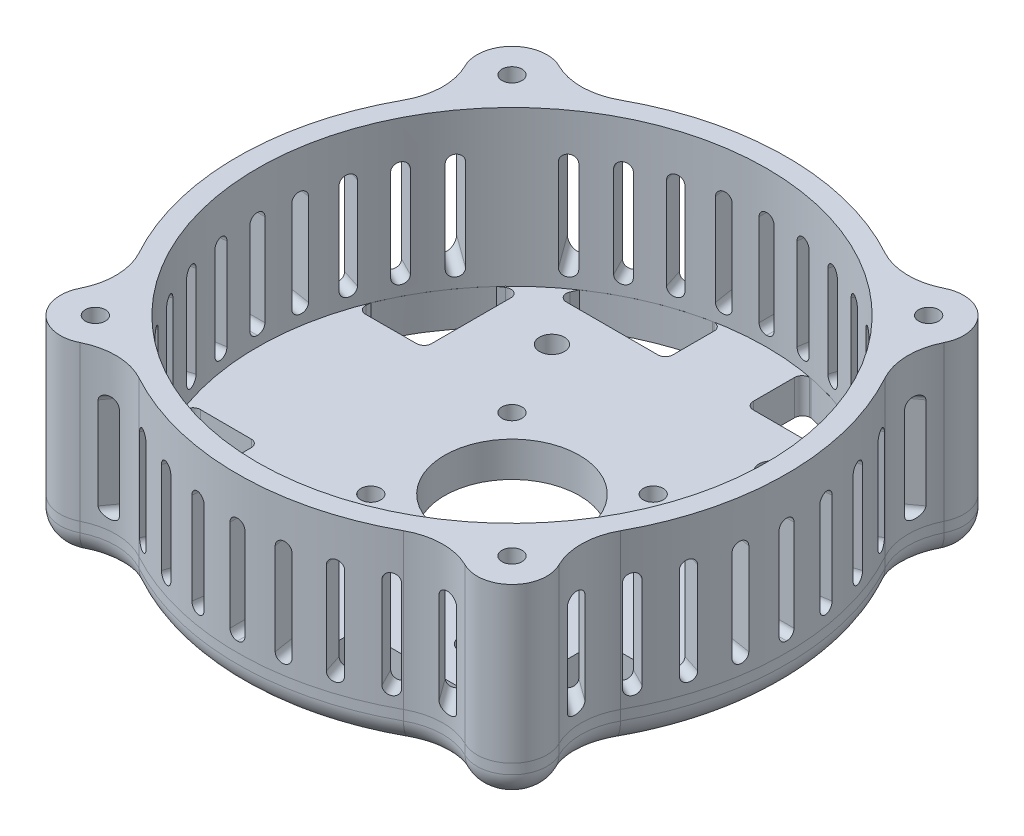
from build123d import *

# Parameters (mm, degrees)
SKETCH1_R                 = 50.99999999999999
SKETCH1_R_2               = 1.9999999999999967
SKETCH1_R_3               = 1.999999999999995
SKETCH1_R_4               = 1.9999999999999991
SKETCH1_R_5               = 1.9999999999999973
BOSS_EXTRUDE1_DEPTH       = 31
SKETCH2_R                 = 2.4999999999999982
SKETCH2_R_2               = 2.000000000000002
SKETCH2_R_3               = 2.000000000000708
SKETCH2_R_4               = 1.9999999999995886
SKETCH2_R_5               = 13.5
SKETCH2_R_6               = 2.0000000000004103
SKETCH2_R_7               = 2.0000000000000036
SKETCH2_R_8               = 1.9999999999999967
SKETCH2_R_9               = 1.999999999999995
BOSS_EXTRUDE2_DEPTH       = 7
FILLET1_R                 = 5
CUT_EXTRUDE1_DEPTH        = 61.000000000000036
CIRPATTERN1_COUNT         = 5
CIRPATTERN1_ANGLE         = 36.00000000000008
MIRROR1_COPY_1_DEPTH      = 61.000000000000036
MIRROR1_COPY_2_DEPTH      = 61.000000000000036
MIRROR1_COPY_3_DEPTH      = 61.000000000000036
MIRROR1_COPY_4_DEPTH      = 61.000000000000036
MIRROR2_COPY_1_DEPTH      = 61.000000000000036
MIRROR2_COPY_2_DEPTH      = 61.000000000000036
MIRROR2_COPY_3_DEPTH      = 61.000000000000036
MIRROR2_COPY_4_DEPTH      = 61.000000000000036
MIRROR2_COPY_5_DEPTH      = 61.000000000000036
MIRROR2_COPY_6_DEPTH      = 61.000000000000036
MIRROR2_COPY_7_DEPTH      = 61.000000000000036
MIRROR2_COPY_8_DEPTH      = 61.000000000000036
MIRROR2_COPY_9_DEPTH      = 61.000000000000036
CIRPATTERN2_COUNT         = 2
CIRPATTERN2_ANGLE         = 90.0000000000002
CIRPATTERN2_COPY_1_DEPTH  = 61.000000000000036
CIRPATTERN2_COPY_2_DEPTH  = 61.000000000000036
CIRPATTERN2_COPY_3_DEPTH  = 61.000000000000036
CIRPATTERN2_COPY_4_DEPTH  = 61.000000000000036
CIRPATTERN2_COPY_5_DEPTH  = 61.000000000000036
CIRPATTERN2_COPY_6_DEPTH  = 61.000000000000036
CIRPATTERN2_COPY_7_DEPTH  = 61.000000000000036
CIRPATTERN2_COPY_8_DEPTH  = 61.000000000000036
CIRPATTERN2_COPY_9_DEPTH  = 61.000000000000036
CIRPATTERN2_COPY_10_DEPTH = 61.000000000000036
CIRPATTERN2_COPY_11_DEPTH = 61.000000000000036
CIRPATTERN2_COPY_12_DEPTH = 61.000000000000036
CIRPATTERN2_COPY_13_DEPTH = 61.000000000000036
CIRPATTERN2_COPY_14_DEPTH = 61.000000000000036
CIRPATTERN2_COPY_15_DEPTH = 61.000000000000036
CIRPATTERN2_COPY_16_DEPTH = 61.000000000000036
CIRPATTERN2_COPY_17_DEPTH = 61.000000000000036
CIRPATTERN2_COPY_18_DEPTH = 61.000000000000036
CIRPATTERN2_COPY_19_DEPTH = 61.000000000000036
SKETCH4_R                 = 4.9999999999999964
SKETCH4_R_2               = 4.999999999999999
SKETCH4_R_3               = 4.999999999999993
SKETCH4_R_4               = 4.999999999999996
CUT_EXTRUDE2_DEPTH        = 15


with BuildPart() as part:
    # Sketch1 → Boss-Extrude1 (new body)
    with BuildSketch(Plane(origin=(0, 0, 0), x_dir=(1, 0, 0), z_dir=(0, 1, 0))):
        with BuildLine():
            ThreePointArc((48.20155884663504, -26.48791658010083), (55.00000000000001, -2.8699e-13), (48.2015588466353, 26.48791658010032))
            ThreePointArc((48.2015588466353, 26.48791658010032), (46.59692233698166, 32.50588686656754), (47.9756748963486, 38.57958969737471))
            ThreePointArc((47.9756748963486, 38.57958969737471), (46.6690486920612, 46.66904869206024), (38.579589697375695, 47.97567489634781))
            ThreePointArc((38.579589697375695, 47.97567489634781), (32.50588686656851, 46.59692233698101), (26.48791658010132, 48.201558846634754))
            ThreePointArc((26.48791658010132, 48.201558846634754), (4.9187e-13, 54.99999999999999), (-26.487916580100485, 48.20155884663524))
            ThreePointArc((-26.487916580100485, 48.20155884663524), (-32.50588686656771, 46.59692233698159), (-38.57958969737487, 47.9756748963485))
            ThreePointArc((-38.57958969737487, 47.9756748963485), (-46.6690486920604, 46.669048692061075), (-47.97567489634794, 38.57958969737556))
            ThreePointArc((-47.97567489634794, 38.57958969737556), (-46.59692233698111, 32.505886866568375), (-48.201558846634846, 26.487916580101178))
            ThreePointArc((-48.201558846634846, 26.487916580101178), (-55.00000000000001, 2.9983e-13), (-48.20155884663513, -26.487916580100645))
            ThreePointArc((-48.20155884663513, -26.487916580100645), (-46.59692233698145, -32.505886866567856), (-47.975674896348345, -38.57958969737503))
            ThreePointArc((-47.975674896348345, -38.57958969737503), (-46.6690486920609, -46.66904869206056), (-38.579589697375376, -47.97567489634807))
            ThreePointArc((-38.579589697375376, -47.97567489634807), (-32.5058868665682, -46.596922336981216), (-26.487916580101, -48.20155884663493))
            ThreePointArc((-26.487916580101, -48.20155884663493), (-9.433e-14, -55), (26.48791658010083, -48.20155884663504))
            ThreePointArc((26.48791658010083, -48.20155884663504), (32.50588686656804, -46.59692233698134), (38.57958969737521, -47.97567489634822))
            ThreePointArc((38.57958969737521, -47.97567489634822), (46.669048692060734, -46.669048692060734), (47.97567489634822, -38.57958969737521))
            ThreePointArc((47.97567489634822, -38.57958969737521), (46.59692233698134, -32.50588686656804), (48.20155884663504, -26.48791658010083))
        make_face()
        with Locations(Location((0, 0, 0), (0, 0, 270))):
            Circle(SKETCH1_R, mode=Mode.SUBTRACT)
        with Locations(Location((41.71930122375488, -41.71930122375488, 0), (0, 0, 270))):
            Circle(SKETCH1_R_2, mode=Mode.SUBTRACT)
        with Locations(Location((-41.71930122375503, -41.71930122375474, 0), (0, 0, 270))):
            Circle(SKETCH1_R_3, mode=Mode.SUBTRACT)
        with Locations(Location((-41.71930122375459, 41.719301223755174, 0), (0, 0, 270))):
            Circle(SKETCH1_R_4, mode=Mode.SUBTRACT)
        with Locations(Location((41.71930122375532, 41.71930122375444, 0), (0, 0, 270))):
            Circle(SKETCH1_R_5, mode=Mode.SUBTRACT)
    extrude(amount=BOSS_EXTRUDE1_DEPTH)

    # Sketch3 → Cut-Extrude1 (cut)
    with BuildSketch(Plane(origin=(0, 0, 0), x_dir=(0, 0, -1), z_dir=(1, 0, 0))):
        with BuildLine():
            Line((-1.4238717555999756, 21.88270378112793), (-1.4238717555999756, 3.5))
            ThreePointArc((-1.4238717555999756, 3.5), (0.03806412220001153, 2.0380641222000127), (1.5, 3.5))
            Line((1.5, 3.5), (1.5, 21.88270378112793))
            ThreePointArc((1.5, 21.88270378112793), (0.03806412220001189, 23.344639658927917), (-1.4238717555999756, 21.88270378112793))
        make_face()
    cut_extrude1 = extrude(amount=CUT_EXTRUDE1_DEPTH, mode=Mode.SUBTRACT)

    # CirPattern1: Cut-Extrude1 ×5 about axis
    cirpattern1_axis = Axis((2.49e-15, 0, -2.81e-15), (0, -1, 0))
    for i in range(1, CIRPATTERN1_COUNT):
        add(cut_extrude1.rotate(cirpattern1_axis, i * CIRPATTERN1_ANGLE / (CIRPATTERN1_COUNT - 1)), mode=Mode.SUBTRACT)

    # Mirror1: Cut-Extrude1 across plane
    add(cut_extrude1.mirror(Plane.XY), mode=Mode.SUBTRACT)

    # Mirror1 copy 1 sketch → Mirror1 copy 1 (cut)
    with BuildSketch(Plane(origin=(-4.1e-16, 0, 4.2e-16), x_dir=(0.1564344650402312, 0, 0.9876883405951377), z_dir=(0.9876883405951377, 0, -0.1564344650402312))):
        with BuildLine():
            Line((-1.4238717555999756, -21.88270378112793), (-1.4238717555999756, -3.5))
            ThreePointArc((-1.4238717555999756, -3.5), (0.03806412220001153, -2.0380641222000127), (1.5, -3.5))
            Line((1.5, -3.5), (1.5, -21.88270378112793))
            ThreePointArc((1.5, -21.88270378112793), (0.03806412220001189, -23.344639658927917), (-1.4238717555999756, -21.88270378112793))
        make_face()
    extrude(amount=MIRROR1_COPY_1_DEPTH, mode=Mode.SUBTRACT)

    # Mirror1 copy 2 sketch → Mirror1 copy 2 (cut)
    with BuildSketch(Plane(origin=(-7.5e-16, 0, 9.1e-16), x_dir=(0.30901699437494806, 0, 0.9510565162951534), z_dir=(0.9510565162951534, 0, -0.30901699437494806))):
        with BuildLine():
            Line((-1.4238717555999756, -21.88270378112793), (-1.4238717555999756, -3.5))
            ThreePointArc((-1.4238717555999756, -3.5), (0.03806412220001153, -2.0380641222000127), (1.5, -3.5))
            Line((1.5, -3.5), (1.5, -21.88270378112793))
            ThreePointArc((1.5, -21.88270378112793), (0.03806412220001189, -23.344639658927917), (-1.4238717555999756, -21.88270378112793))
        make_face()
    extrude(amount=MIRROR1_COPY_2_DEPTH, mode=Mode.SUBTRACT)

    # Mirror1 copy 3 sketch → Mirror1 copy 3 (cut)
    with BuildSketch(Plane(origin=(-1e-15, 0, 1.44e-15), x_dir=(0.4539904997395477, 0, 0.8910065241883675), z_dir=(0.8910065241883675, 0, -0.4539904997395477))):
        with BuildLine():
            Line((-1.4238717555999756, -21.88270378112793), (-1.4238717555999756, -3.5))
            ThreePointArc((-1.4238717555999756, -3.5), (0.03806412220001153, -2.0380641222000127), (1.5, -3.5))
            Line((1.5, -3.5), (1.5, -21.88270378112793))
            ThreePointArc((1.5, -21.88270378112793), (0.03806412220001189, -23.344639658927917), (-1.4238717555999756, -21.88270378112793))
        make_face()
    extrude(amount=MIRROR1_COPY_3_DEPTH, mode=Mode.SUBTRACT)

    # Mirror1 copy 4 sketch → Mirror1 copy 4 (cut)
    with BuildSketch(Plane(origin=(-1.18e-15, 0, 2e-15), x_dir=(0.5877852522924741, 0, 0.8090169943749467), z_dir=(0.8090169943749467, 0, -0.5877852522924741))):
        with BuildLine():
            Line((-1.4238717555999756, -21.88270378112793), (-1.4238717555999756, -3.5))
            ThreePointArc((-1.4238717555999756, -3.5), (0.03806412220001153, -2.0380641222000127), (1.5, -3.5))
            Line((1.5, -3.5), (1.5, -21.88270378112793))
            ThreePointArc((1.5, -21.88270378112793), (0.03806412220001189, -23.344639658927917), (-1.4238717555999756, -21.88270378112793))
        make_face()
    extrude(amount=MIRROR1_COPY_4_DEPTH, mode=Mode.SUBTRACT)

    # Mirror2: Cut-Extrude1 across plane
    add(cut_extrude1.mirror(Plane(origin=(0, 0, 0), x_dir=(0, 0, 1), z_dir=(1, 0, 0))), mode=Mode.SUBTRACT)

    # Mirror2 copy 1 sketch → Mirror2 copy 1 (cut)
    with BuildSketch(Plane(origin=(4.1e-16, 0, -4.2e-16), x_dir=(-0.1564344650402312, 0, -0.9876883405951377), z_dir=(-0.9876883405951377, 0, 0.1564344650402312))):
        with BuildLine():
            Line((-1.4238717555999756, -21.88270378112793), (-1.4238717555999756, -3.5))
            ThreePointArc((-1.4238717555999756, -3.5), (0.03806412220001153, -2.0380641222000127), (1.5, -3.5))
            Line((1.5, -3.5), (1.5, -21.88270378112793))
            ThreePointArc((1.5, -21.88270378112793), (0.03806412220001189, -23.344639658927917), (-1.4238717555999756, -21.88270378112793))
        make_face()
    extrude(amount=MIRROR2_COPY_1_DEPTH, mode=Mode.SUBTRACT)

    # Mirror2 copy 2 sketch → Mirror2 copy 2 (cut)
    with BuildSketch(Plane(origin=(7.5e-16, 0, -9.1e-16), x_dir=(-0.30901699437494806, 0, -0.9510565162951534), z_dir=(-0.9510565162951534, 0, 0.30901699437494806))):
        with BuildLine():
            Line((-1.4238717555999756, -21.88270378112793), (-1.4238717555999756, -3.5))
            ThreePointArc((-1.4238717555999756, -3.5), (0.03806412220001153, -2.0380641222000127), (1.5, -3.5))
            Line((1.5, -3.5), (1.5, -21.88270378112793))
            ThreePointArc((1.5, -21.88270378112793), (0.03806412220001189, -23.344639658927917), (-1.4238717555999756, -21.88270378112793))
        make_face()
    extrude(amount=MIRROR2_COPY_2_DEPTH, mode=Mode.SUBTRACT)

    # Mirror2 copy 3 sketch → Mirror2 copy 3 (cut)
    with BuildSketch(Plane(origin=(1e-15, 0, -1.44e-15), x_dir=(-0.4539904997395477, 0, -0.8910065241883675), z_dir=(-0.8910065241883675, 0, 0.4539904997395477))):
        with BuildLine():
            Line((-1.4238717555999756, -21.88270378112793), (-1.4238717555999756, -3.5))
            ThreePointArc((-1.4238717555999756, -3.5), (0.03806412220001153, -2.0380641222000127), (1.5, -3.5))
            Line((1.5, -3.5), (1.5, -21.88270378112793))
            ThreePointArc((1.5, -21.88270378112793), (0.03806412220001189, -23.344639658927917), (-1.4238717555999756, -21.88270378112793))
        make_face()
    extrude(amount=MIRROR2_COPY_3_DEPTH, mode=Mode.SUBTRACT)

    # Mirror2 copy 4 sketch → Mirror2 copy 4 (cut)
    with BuildSketch(Plane(origin=(1.18e-15, 0, -2e-15), x_dir=(-0.5877852522924741, 0, -0.8090169943749467), z_dir=(-0.8090169943749467, 0, 0.5877852522924741))):
        with BuildLine():
            Line((-1.4238717555999756, -21.88270378112793), (-1.4238717555999756, -3.5))
            ThreePointArc((-1.4238717555999756, -3.5), (0.03806412220001153, -2.0380641222000127), (1.5, -3.5))
            Line((1.5, -3.5), (1.5, -21.88270378112793))
            ThreePointArc((1.5, -21.88270378112793), (0.03806412220001189, -23.344639658927917), (-1.4238717555999756, -21.88270378112793))
        make_face()
    extrude(amount=MIRROR2_COPY_4_DEPTH, mode=Mode.SUBTRACT)

    # Mirror2 copy 5 sketch → Mirror2 copy 5 (cut)
    with BuildSketch(Plane.ZY):
        with BuildLine():
            Line((-1.4238717555999756, 21.88270378112793), (-1.4238717555999756, 3.5))
            ThreePointArc((-1.4238717555999756, 3.5), (0.03806412220001153, 2.0380641222000127), (1.5, 3.5))
            Line((1.5, 3.5), (1.5, 21.88270378112793))
            ThreePointArc((1.5, 21.88270378112793), (0.03806412220001189, 23.344639658927917), (-1.4238717555999756, 21.88270378112793))
        make_face()
    extrude(amount=MIRROR2_COPY_5_DEPTH, mode=Mode.SUBTRACT)

    # Mirror2 copy 6 sketch → Mirror2 copy 6 (cut)
    with BuildSketch(Plane(origin=(4.1e-16, 0, 4.2e-16), x_dir=(-0.1564344650402312, 0, 0.9876883405951377), z_dir=(-0.9876883405951377, 0, -0.1564344650402312))):
        with BuildLine():
            Line((-1.4238717555999756, 21.88270378112793), (-1.4238717555999756, 3.5))
            ThreePointArc((-1.4238717555999756, 3.5), (0.03806412220001153, 2.0380641222000127), (1.5, 3.5))
            Line((1.5, 3.5), (1.5, 21.88270378112793))
            ThreePointArc((1.5, 21.88270378112793), (0.03806412220001189, 23.344639658927917), (-1.4238717555999756, 21.88270378112793))
        make_face()
    extrude(amount=MIRROR2_COPY_6_DEPTH, mode=Mode.SUBTRACT)

    # Mirror2 copy 7 sketch → Mirror2 copy 7 (cut)
    with BuildSketch(Plane(origin=(7.5e-16, 0, 9.1e-16), x_dir=(-0.30901699437494806, 0, 0.9510565162951534), z_dir=(-0.9510565162951534, 0, -0.30901699437494806))):
        with BuildLine():
            Line((-1.4238717555999756, 21.88270378112793), (-1.4238717555999756, 3.5))
            ThreePointArc((-1.4238717555999756, 3.5), (0.03806412220001153, 2.0380641222000127), (1.5, 3.5))
            Line((1.5, 3.5), (1.5, 21.88270378112793))
            ThreePointArc((1.5, 21.88270378112793), (0.03806412220001189, 23.344639658927917), (-1.4238717555999756, 21.88270378112793))
        make_face()
    extrude(amount=MIRROR2_COPY_7_DEPTH, mode=Mode.SUBTRACT)

    # Mirror2 copy 8 sketch → Mirror2 copy 8 (cut)
    with BuildSketch(Plane(origin=(1e-15, 0, 1.44e-15), x_dir=(-0.4539904997395477, 0, 0.8910065241883675), z_dir=(-0.8910065241883675, 0, -0.4539904997395477))):
        with BuildLine():
            Line((-1.4238717555999756, 21.88270378112793), (-1.4238717555999756, 3.5))
            ThreePointArc((-1.4238717555999756, 3.5), (0.03806412220001153, 2.0380641222000127), (1.5, 3.5))
            Line((1.5, 3.5), (1.5, 21.88270378112793))
            ThreePointArc((1.5, 21.88270378112793), (0.03806412220001189, 23.344639658927917), (-1.4238717555999756, 21.88270378112793))
        make_face()
    extrude(amount=MIRROR2_COPY_8_DEPTH, mode=Mode.SUBTRACT)

    # Mirror2 copy 9 sketch → Mirror2 copy 9 (cut)
    with BuildSketch(Plane(origin=(1.18e-15, 0, 2e-15), x_dir=(-0.5877852522924741, 0, 0.8090169943749467), z_dir=(-0.8090169943749467, 0, -0.5877852522924741))):
        with BuildLine():
            Line((-1.4238717555999756, 21.88270378112793), (-1.4238717555999756, 3.5))
            ThreePointArc((-1.4238717555999756, 3.5), (0.03806412220001153, 2.0380641222000127), (1.5, 3.5))
            Line((1.5, 3.5), (1.5, 21.88270378112793))
            ThreePointArc((1.5, 21.88270378112793), (0.03806412220001189, 23.344639658927917), (-1.4238717555999756, 21.88270378112793))
        make_face()
    extrude(amount=MIRROR2_COPY_9_DEPTH, mode=Mode.SUBTRACT)

    # CirPattern2: Cut-Extrude1 ×2 about axis
    cirpattern2_axis = Axis((0, 31, 0), (0, -1, 0))
    for i in range(1, CIRPATTERN2_COUNT):
        add(cut_extrude1.rotate(cirpattern2_axis, i * CIRPATTERN2_ANGLE / (CIRPATTERN2_COUNT - 1)), mode=Mode.SUBTRACT)

    # CirPattern2 copy 1 sketch → CirPattern2 copy 1 (cut)
    with BuildSketch(Plane(origin=(4.2e-16, 0, -4.1e-16), x_dir=(0.9876883405951371, 0, 0.15643446504023464), z_dir=(-0.15643446504023464, 0, 0.9876883405951371))):
        with BuildLine():
            Line((-1.4238717555999756, 21.88270378112793), (-1.4238717555999756, 3.5))
            ThreePointArc((-1.4238717555999756, 3.5), (0.03806412220001153, 2.0380641222000127), (1.5, 3.5))
            Line((1.5, 3.5), (1.5, 21.88270378112793))
            ThreePointArc((1.5, 21.88270378112793), (0.03806412220001189, 23.344639658927917), (-1.4238717555999756, 21.88270378112793))
        make_face()
    extrude(amount=CIRPATTERN2_COPY_1_DEPTH, mode=Mode.SUBTRACT)

    # CirPattern2 copy 2 sketch → CirPattern2 copy 2 (cut)
    with BuildSketch(Plane(origin=(9.1e-16, 0, -7.5e-16), x_dir=(0.9510565162951523, 0, 0.3090169943749514), z_dir=(-0.3090169943749514, 0, 0.9510565162951523))):
        with BuildLine():
            Line((-1.4238717555999756, 21.88270378112793), (-1.4238717555999756, 3.5))
            ThreePointArc((-1.4238717555999756, 3.5), (0.03806412220001153, 2.0380641222000127), (1.5, 3.5))
            Line((1.5, 3.5), (1.5, 21.88270378112793))
            ThreePointArc((1.5, 21.88270378112793), (0.03806412220001189, 23.344639658927917), (-1.4238717555999756, 21.88270378112793))
        make_face()
    extrude(amount=CIRPATTERN2_COPY_2_DEPTH, mode=Mode.SUBTRACT)

    # CirPattern2 copy 3 sketch → CirPattern2 copy 3 (cut)
    with BuildSketch(Plane(origin=(1.44e-15, 0, -1e-15), x_dir=(0.8910065241883659, 0, 0.4539904997395508), z_dir=(-0.4539904997395508, 0, 0.8910065241883659))):
        with BuildLine():
            Line((-1.4238717555999756, 21.88270378112793), (-1.4238717555999756, 3.5))
            ThreePointArc((-1.4238717555999756, 3.5), (0.03806412220001153, 2.0380641222000127), (1.5, 3.5))
            Line((1.5, 3.5), (1.5, 21.88270378112793))
            ThreePointArc((1.5, 21.88270378112793), (0.03806412220001189, 23.344639658927917), (-1.4238717555999756, 21.88270378112793))
        make_face()
    extrude(amount=CIRPATTERN2_COPY_3_DEPTH, mode=Mode.SUBTRACT)

    # CirPattern2 copy 4 sketch → CirPattern2 copy 4 (cut)
    with BuildSketch(Plane(origin=(2e-15, 0, -1.18e-15), x_dir=(0.8090169943749447, 0, 0.5877852522924769), z_dir=(-0.5877852522924769, 0, 0.8090169943749447))):
        with BuildLine():
            Line((-1.4238717555999756, 21.88270378112793), (-1.4238717555999756, 3.5))
            ThreePointArc((-1.4238717555999756, 3.5), (0.03806412220001153, 2.0380641222000127), (1.5, 3.5))
            Line((1.5, 3.5), (1.5, 21.88270378112793))
            ThreePointArc((1.5, 21.88270378112793), (0.03806412220001189, 23.344639658927917), (-1.4238717555999756, 21.88270378112793))
        make_face()
    extrude(amount=CIRPATTERN2_COPY_4_DEPTH, mode=Mode.SUBTRACT)

    # CirPattern2 copy 5 sketch → CirPattern2 copy 5 (cut)
    with BuildSketch(Plane(origin=(0, 0, 0), x_dir=(-1, 0, -3.49e-15), z_dir=(-3.49e-15, 0, 1))):
        with BuildLine():
            Line((-1.4238717555999756, -21.88270378112793), (-1.4238717555999756, -3.5))
            ThreePointArc((-1.4238717555999756, -3.5), (0.03806412220001153, -2.0380641222000127), (1.5, -3.5))
            Line((1.5, -3.5), (1.5, -21.88270378112793))
            ThreePointArc((1.5, -21.88270378112793), (0.03806412220001189, -23.344639658927917), (-1.4238717555999756, -21.88270378112793))
        make_face()
    extrude(amount=CIRPATTERN2_COPY_5_DEPTH, mode=Mode.SUBTRACT)

    # CirPattern2 copy 6 sketch → CirPattern2 copy 6 (cut)
    with BuildSketch(Plane(origin=(-4.2e-16, 0, -4.1e-16), x_dir=(-0.9876883405951382, 0, 0.15643446504022776), z_dir=(0.15643446504022776, 0, 0.9876883405951382))):
        with BuildLine():
            Line((-1.4238717555999756, -21.88270378112793), (-1.4238717555999756, -3.5))
            ThreePointArc((-1.4238717555999756, -3.5), (0.03806412220001153, -2.0380641222000127), (1.5, -3.5))
            Line((1.5, -3.5), (1.5, -21.88270378112793))
            ThreePointArc((1.5, -21.88270378112793), (0.03806412220001189, -23.344639658927917), (-1.4238717555999756, -21.88270378112793))
        make_face()
    extrude(amount=CIRPATTERN2_COPY_6_DEPTH, mode=Mode.SUBTRACT)

    # CirPattern2 copy 7 sketch → CirPattern2 copy 7 (cut)
    with BuildSketch(Plane(origin=(-9.1e-16, 0, -7.5e-16), x_dir=(-0.9510565162951545, 0, 0.30901699437494473), z_dir=(0.30901699437494473, 0, 0.9510565162951545))):
        with BuildLine():
            Line((-1.4238717555999756, -21.88270378112793), (-1.4238717555999756, -3.5))
            ThreePointArc((-1.4238717555999756, -3.5), (0.03806412220001153, -2.0380641222000127), (1.5, -3.5))
            Line((1.5, -3.5), (1.5, -21.88270378112793))
            ThreePointArc((1.5, -21.88270378112793), (0.03806412220001189, -23.344639658927917), (-1.4238717555999756, -21.88270378112793))
        make_face()
    extrude(amount=CIRPATTERN2_COPY_7_DEPTH, mode=Mode.SUBTRACT)

    # CirPattern2 copy 8 sketch → CirPattern2 copy 8 (cut)
    with BuildSketch(Plane(origin=(-1.44e-15, 0, -1e-15), x_dir=(-0.891006524188369, 0, 0.4539904997395446), z_dir=(0.4539904997395446, 0, 0.891006524188369))):
        with BuildLine():
            Line((-1.4238717555999756, -21.88270378112793), (-1.4238717555999756, -3.5))
            ThreePointArc((-1.4238717555999756, -3.5), (0.03806412220001153, -2.0380641222000127), (1.5, -3.5))
            Line((1.5, -3.5), (1.5, -21.88270378112793))
            ThreePointArc((1.5, -21.88270378112793), (0.03806412220001189, -23.344639658927917), (-1.4238717555999756, -21.88270378112793))
        make_face()
    extrude(amount=CIRPATTERN2_COPY_8_DEPTH, mode=Mode.SUBTRACT)

    # CirPattern2 copy 9 sketch → CirPattern2 copy 9 (cut)
    with BuildSketch(Plane(origin=(-2e-15, 0, -1.18e-15), x_dir=(-0.8090169943749487, 0, 0.5877852522924714), z_dir=(0.5877852522924714, 0, 0.8090169943749487))):
        with BuildLine():
            Line((-1.4238717555999756, -21.88270378112793), (-1.4238717555999756, -3.5))
            ThreePointArc((-1.4238717555999756, -3.5), (0.03806412220001153, -2.0380641222000127), (1.5, -3.5))
            Line((1.5, -3.5), (1.5, -21.88270378112793))
            ThreePointArc((1.5, -21.88270378112793), (0.03806412220001189, -23.344639658927917), (-1.4238717555999756, -21.88270378112793))
        make_face()
    extrude(amount=CIRPATTERN2_COPY_9_DEPTH, mode=Mode.SUBTRACT)

    # CirPattern2 copy 10 sketch → CirPattern2 copy 10 (cut)
    with BuildSketch(Plane(origin=(0, 0, 0), x_dir=(1, 0, 3.49e-15), z_dir=(3.49e-15, 0, -1))):
        with BuildLine():
            Line((-1.4238717555999756, -21.88270378112793), (-1.4238717555999756, -3.5))
            ThreePointArc((-1.4238717555999756, -3.5), (0.03806412220001153, -2.0380641222000127), (1.5, -3.5))
            Line((1.5, -3.5), (1.5, -21.88270378112793))
            ThreePointArc((1.5, -21.88270378112793), (0.03806412220001189, -23.344639658927917), (-1.4238717555999756, -21.88270378112793))
        make_face()
    extrude(amount=CIRPATTERN2_COPY_10_DEPTH, mode=Mode.SUBTRACT)

    # CirPattern2 copy 11 sketch → CirPattern2 copy 11 (cut)
    with BuildSketch(Plane(origin=(4.2e-16, 0, 4.1e-16), x_dir=(0.9876883405951382, 0, -0.15643446504022776), z_dir=(-0.15643446504022776, 0, -0.9876883405951382))):
        with BuildLine():
            Line((-1.4238717555999756, -21.88270378112793), (-1.4238717555999756, -3.5))
            ThreePointArc((-1.4238717555999756, -3.5), (0.03806412220001153, -2.0380641222000127), (1.5, -3.5))
            Line((1.5, -3.5), (1.5, -21.88270378112793))
            ThreePointArc((1.5, -21.88270378112793), (0.03806412220001189, -23.344639658927917), (-1.4238717555999756, -21.88270378112793))
        make_face()
    extrude(amount=CIRPATTERN2_COPY_11_DEPTH, mode=Mode.SUBTRACT)

    # CirPattern2 copy 12 sketch → CirPattern2 copy 12 (cut)
    with BuildSketch(Plane(origin=(9.1e-16, 0, 7.5e-16), x_dir=(0.9510565162951545, 0, -0.30901699437494473), z_dir=(-0.30901699437494473, 0, -0.9510565162951545))):
        with BuildLine():
            Line((-1.4238717555999756, -21.88270378112793), (-1.4238717555999756, -3.5))
            ThreePointArc((-1.4238717555999756, -3.5), (0.03806412220001153, -2.0380641222000127), (1.5, -3.5))
            Line((1.5, -3.5), (1.5, -21.88270378112793))
            ThreePointArc((1.5, -21.88270378112793), (0.03806412220001189, -23.344639658927917), (-1.4238717555999756, -21.88270378112793))
        make_face()
    extrude(amount=CIRPATTERN2_COPY_12_DEPTH, mode=Mode.SUBTRACT)

    # CirPattern2 copy 13 sketch → CirPattern2 copy 13 (cut)
    with BuildSketch(Plane(origin=(1.44e-15, 0, 1e-15), x_dir=(0.891006524188369, 0, -0.4539904997395446), z_dir=(-0.4539904997395446, 0, -0.891006524188369))):
        with BuildLine():
            Line((-1.4238717555999756, -21.88270378112793), (-1.4238717555999756, -3.5))
            ThreePointArc((-1.4238717555999756, -3.5), (0.03806412220001153, -2.0380641222000127), (1.5, -3.5))
            Line((1.5, -3.5), (1.5, -21.88270378112793))
            ThreePointArc((1.5, -21.88270378112793), (0.03806412220001189, -23.344639658927917), (-1.4238717555999756, -21.88270378112793))
        make_face()
    extrude(amount=CIRPATTERN2_COPY_13_DEPTH, mode=Mode.SUBTRACT)

    # CirPattern2 copy 14 sketch → CirPattern2 copy 14 (cut)
    with BuildSketch(Plane(origin=(2e-15, 0, 1.18e-15), x_dir=(0.8090169943749487, 0, -0.5877852522924714), z_dir=(-0.5877852522924714, 0, -0.8090169943749487))):
        with BuildLine():
            Line((-1.4238717555999756, -21.88270378112793), (-1.4238717555999756, -3.5))
            ThreePointArc((-1.4238717555999756, -3.5), (0.03806412220001153, -2.0380641222000127), (1.5, -3.5))
            Line((1.5, -3.5), (1.5, -21.88270378112793))
            ThreePointArc((1.5, -21.88270378112793), (0.03806412220001189, -23.344639658927917), (-1.4238717555999756, -21.88270378112793))
        make_face()
    extrude(amount=CIRPATTERN2_COPY_14_DEPTH, mode=Mode.SUBTRACT)

    # CirPattern2 copy 15 sketch → CirPattern2 copy 15 (cut)
    with BuildSketch(Plane(origin=(0, 0, 0), x_dir=(-1, 0, -3.49e-15), z_dir=(3.49e-15, 0, -1))):
        with BuildLine():
            Line((-1.4238717555999756, 21.88270378112793), (-1.4238717555999756, 3.5))
            ThreePointArc((-1.4238717555999756, 3.5), (0.03806412220001153, 2.0380641222000127), (1.5, 3.5))
            Line((1.5, 3.5), (1.5, 21.88270378112793))
            ThreePointArc((1.5, 21.88270378112793), (0.03806412220001189, 23.344639658927917), (-1.4238717555999756, 21.88270378112793))
        make_face()
    extrude(amount=CIRPATTERN2_COPY_15_DEPTH, mode=Mode.SUBTRACT)

    # CirPattern2 copy 16 sketch → CirPattern2 copy 16 (cut)
    with BuildSketch(Plane(origin=(-4.2e-16, 0, 4.1e-16), x_dir=(-0.9876883405951371, 0, -0.15643446504023464), z_dir=(0.15643446504023464, 0, -0.9876883405951371))):
        with BuildLine():
            Line((-1.4238717555999756, 21.88270378112793), (-1.4238717555999756, 3.5))
            ThreePointArc((-1.4238717555999756, 3.5), (0.03806412220001153, 2.0380641222000127), (1.5, 3.5))
            Line((1.5, 3.5), (1.5, 21.88270378112793))
            ThreePointArc((1.5, 21.88270378112793), (0.03806412220001189, 23.344639658927917), (-1.4238717555999756, 21.88270378112793))
        make_face()
    extrude(amount=CIRPATTERN2_COPY_16_DEPTH, mode=Mode.SUBTRACT)

    # CirPattern2 copy 17 sketch → CirPattern2 copy 17 (cut)
    with BuildSketch(Plane(origin=(-9.1e-16, 0, 7.5e-16), x_dir=(-0.9510565162951523, 0, -0.3090169943749514), z_dir=(0.3090169943749514, 0, -0.9510565162951523))):
        with BuildLine():
            Line((-1.4238717555999756, 21.88270378112793), (-1.4238717555999756, 3.5))
            ThreePointArc((-1.4238717555999756, 3.5), (0.03806412220001153, 2.0380641222000127), (1.5, 3.5))
            Line((1.5, 3.5), (1.5, 21.88270378112793))
            ThreePointArc((1.5, 21.88270378112793), (0.03806412220001189, 23.344639658927917), (-1.4238717555999756, 21.88270378112793))
        make_face()
    extrude(amount=CIRPATTERN2_COPY_17_DEPTH, mode=Mode.SUBTRACT)

    # CirPattern2 copy 18 sketch → CirPattern2 copy 18 (cut)
    with BuildSketch(Plane(origin=(-1.44e-15, 0, 1e-15), x_dir=(-0.8910065241883659, 0, -0.4539904997395508), z_dir=(0.4539904997395508, 0, -0.8910065241883659))):
        with BuildLine():
            Line((-1.4238717555999756, 21.88270378112793), (-1.4238717555999756, 3.5))
            ThreePointArc((-1.4238717555999756, 3.5), (0.03806412220001153, 2.0380641222000127), (1.5, 3.5))
            Line((1.5, 3.5), (1.5, 21.88270378112793))
            ThreePointArc((1.5, 21.88270378112793), (0.03806412220001189, 23.344639658927917), (-1.4238717555999756, 21.88270378112793))
        make_face()
    extrude(amount=CIRPATTERN2_COPY_18_DEPTH, mode=Mode.SUBTRACT)

    # CirPattern2 copy 19 sketch → CirPattern2 copy 19 (cut)
    with BuildSketch(Plane(origin=(-2e-15, 0, 1.18e-15), x_dir=(-0.8090169943749447, 0, -0.5877852522924769), z_dir=(0.5877852522924769, 0, -0.8090169943749447))):
        with BuildLine():
            Line((-1.4238717555999756, 21.88270378112793), (-1.4238717555999756, 3.5))
            ThreePointArc((-1.4238717555999756, 3.5), (0.03806412220001153, 2.0380641222000127), (1.5, 3.5))
            Line((1.5, 3.5), (1.5, 21.88270378112793))
            ThreePointArc((1.5, 21.88270378112793), (0.03806412220001189, 23.344639658927917), (-1.4238717555999756, 21.88270378112793))
        make_face()
    extrude(amount=CIRPATTERN2_COPY_19_DEPTH, mode=Mode.SUBTRACT)


with BuildPart() as body_2:
    # Sketch2 → Boss-Extrude2 (new body)
    with BuildSketch(Plane.XZ):
        with BuildLine():
            ThreePointArc((48.201558846635024, 26.487916580100833), (46.596922336981336, 32.50588686656804), (47.97567489634821, 38.57958969737521))
            ThreePointArc((47.97567489634822, 38.57958969737521), (46.66904869206073, 46.66904869206073), (38.57958969737521, 47.97567489634822))
            ThreePointArc((38.579589697375205, 47.97567489634822), (32.505886866568034, 46.596922336981336), (26.487916580100833, 48.20155884663503))
            ThreePointArc((26.487916580100833, 48.20155884663503), (-1.1369e-13, 55), (-26.487916580101025, 48.20155884663492))
            ThreePointArc((-26.487916580101018, 48.201558846634924), (-32.50588686656821, 46.59692233698121), (-38.579589697375376, 47.97567489634807))
            ThreePointArc((-38.579589697375376, 47.97567489634807), (-46.669048692060905, 46.669048692060564), (-47.97567489634835, 38.57958969737503))
            ThreePointArc((-47.975674896348345, 38.57958969737503), (-46.596922336981464, 32.50588686656786), (-48.20155884663514, 26.487916580100652))
            ThreePointArc((-48.201558846635145, 26.487916580100656), (-55.000000000000014, -3.0909e-13), (-48.20155884663484, -26.487916580101196))
            ThreePointArc((-48.20155884663484, -26.487916580101185), (-46.59692233698111, -32.50588686656838), (-47.97567489634794, -38.57958969737556))
            ThreePointArc((-47.97567489634794, -38.57958969737556), (-46.66904869206039, -46.66904869206106), (-38.57958969737487, -47.9756748963485))
            ThreePointArc((-38.57958969737487, -47.9756748963485), (-32.50588686656769, -46.59692233698158), (-26.487916580100467, -48.20155884663525))
            ThreePointArc((-26.487916580100464, -48.201558846635244), (4.8317e-13, -55.00000000000003), (26.487916580101313, -48.20155884663477))
            ThreePointArc((26.487916580101313, -48.20155884663477), (32.5058868665685, -46.59692233698101), (38.579589697375695, -47.97567489634781))
            ThreePointArc((38.579589697375695, -47.975674896347805), (46.669048692061224, -46.66904869206026), (47.97567489634861, -38.57958969737469))
            ThreePointArc((47.9756748963486, -38.5795896973747), (46.59692233698168, -32.50588686656755), (48.201558846635294, -26.48791658010033))
            ThreePointArc((48.201558846635294, -26.48791658010033), (54.999999999999986, 2.8511e-13), (48.201558846635024, 26.487916580100837))
        make_face()
        with BuildLine():
            Line((-27.89206044481231, -38.76250076293945), (-9.550250081633774, -38.76250076293945))
            ThreePointArc((-9.550250081633774, -38.76250076293945), (-8.489589909853947, -39.20184059115963), (-8.05025008163377, -40.26250076293945))
            Line((-8.050250081633768, -40.26250076293945), (-8.050250081633765, -48.54065442483437))
            ThreePointArc((-8.050250081633768, -48.54065442483437), (-8.489589909853944, -49.601314596614195), (-9.550250081633767, -50.04065442483437))
            Line((-9.550250081633767, -50.04065442483437), (-9.845450966527801, -50.04065442483437))
            ThreePointArc((-9.845450966527808, -50.04065442483437), (-19.66764370916644, -47.05511439715438), (-28.692930753912627, -42.162966270782874))
            Line((-28.692930753912623, -42.162966270782874), (-29.264366468666793, -40.868121252101346))
            ThreePointArc((-29.264366468666793, -40.868121252101346), (-29.148728804751165, -39.44348633502711), (-27.89206044481231, -38.76250076293945))
        make_face(mode=Mode.SUBTRACT)
        with BuildLine():
            Line((-36.48587151578372, -35.20180433041292), (-37.569662884734065, -34.489424911520835))
            ThreePointArc((-37.56966288473407, -34.48942491152084), (-43.12934773325063, -27.218731860693797), (-47.299921471257285, -19.071377213323984))
            Line((-47.29992147125728, -19.071377213324), (-47.3752811510203, -18.145147050596414))
            ThreePointArc((-47.3752811510203, -18.145147050596414), (-46.98157410742776, -17.00516350620726), (-45.87587059972981, -16.52351272948529))
            Line((-45.87587059972981, -16.52351272948529), (-35.65761358204051, -16.553151484023317))
            ThreePointArc((-35.65761358204051, -16.553151484023317), (-34.59976710627969, -16.99402437165398), (-34.161964416503906, -18.05314517408988))
            Line((-34.161964416503906, -18.05314517408988), (-34.161964416503906, -33.948338299059714))
            ThreePointArc((-34.161964416503906, -33.948338299059714), (-34.94987616667798, -35.268539164254065), (-36.48587151578372, -35.20180433041292))
        make_face(mode=Mode.SUBTRACT)
        with BuildLine():
            Line((-47.3752811510203, 18.145147050596414), (-47.29992147125728, 19.071377213324))
            ThreePointArc((-47.299921471257285, 19.071377213323995), (-43.129347733250626, 27.21873186069381), (-37.56966288473406, 34.48942491152085))
            Line((-37.569662884734065, 34.489424911520835), (-36.48587151578372, 35.20180433041292))
            ThreePointArc((-36.48587151578372, 35.20180433041292), (-34.94987616667798, 35.268539164254065), (-34.161964416503906, 33.948338299059714))
            Line((-34.161964416503906, 33.948338299059714), (-34.161964416503906, 18.05314517408988))
            ThreePointArc((-34.161964416503906, 18.05314517408988), (-34.59976710627969, 16.99402437165398), (-35.65761358204051, 16.553151484023317))
            Line((-35.65761358204051, 16.553151484023317), (-45.87587059972981, 16.52351272948529))
            ThreePointArc((-45.87587059972981, 16.52351272948529), (-46.98157410742776, 17.00516350620726), (-47.3752811510203, 18.145147050596414))
        make_face(mode=Mode.SUBTRACT)
        with BuildLine():
            Line((-29.26436646866679, 40.86812125210136), (-28.692930753912623, 42.162966270782874))
            ThreePointArc((-28.692930753912616, 42.16296627078288), (-19.667643709166455, 47.05511439715437), (-9.845450966527798, 50.04065442483437))
            Line((-9.845450966527801, 50.04065442483437), (-9.550250081633774, 50.04065442483437))
            ThreePointArc((-9.550250081633774, 50.04065442483437), (-8.489589909853944, 49.601314596614195), (-8.050250081633765, 48.540654424834365))
            Line((-8.050250081633765, 48.540654424834365), (-8.050250081633765, 40.26250076293946))
            ThreePointArc((-8.050250081633765, 40.26250076293946), (-8.489589909853944, 39.20184059115963), (-9.550250081633774, 38.76250076293945))
            Line((-9.550250081633774, 38.76250076293945), (-27.89206044481229, 38.76250076293945))
            ThreePointArc((-27.89206044481229, 38.76250076293945), (-29.148728804751165, 39.44348633502711), (-29.26436646866679, 40.86812125210136))
        make_face(mode=Mode.SUBTRACT)
        with BuildLine():
            Line((9.550250081633774, 50.04065442483437), (9.845450966527801, 50.04065442483437))
            ThreePointArc((9.845450966527803, 50.04065442483437), (19.66764370916646, 47.05511439715437), (28.69293075391262, 42.16296627078288))
            Line((28.692930753912623, 42.162966270782874), (29.26436646866679, 40.86812125210136))
            ThreePointArc((29.26436646866679, 40.86812125210136), (29.148728804751165, 39.44348633502711), (27.89206044481229, 38.76250076293945))
            Line((27.89206044481229, 38.76250076293945), (9.550250081633774, 38.76250076293945))
            ThreePointArc((9.550250081633774, 38.76250076293945), (8.489589909853944, 39.20184059115963), (8.050250081633765, 40.26250076293946))
            Line((8.050250081633765, 40.26250076293946), (8.050250081633765, 48.540654424834365))
            ThreePointArc((8.050250081633765, 48.540654424834365), (8.489589909853944, 49.601314596614195), (9.550250081633774, 50.04065442483437))
        make_face(mode=Mode.SUBTRACT)
        with BuildLine():
            Line((36.48587151578372, 35.20180433041292), (37.569662884734065, 34.489424911520835))
            ThreePointArc((37.569662884734065, 34.48942491152084), (43.129347733250626, 27.218731860693804), (47.29992147125728, 19.071377213324))
            Line((47.29992147125728, 19.071377213324), (47.3752811510203, 18.145147050596414))
            ThreePointArc((47.3752811510203, 18.145147050596414), (46.98157410742776, 17.00516350620726), (45.87587059972981, 16.52351272948529))
            Line((45.87587059972981, 16.52351272948529), (35.65761358204051, 16.553151484023317))
            ThreePointArc((35.65761358204051, 16.553151484023317), (34.59976710627969, 16.99402437165398), (34.161964416503906, 18.05314517408988))
            Line((34.161964416503906, 18.05314517408988), (34.161964416503906, 33.948338299059714))
            ThreePointArc((34.161964416503906, 33.948338299059714), (34.94987616667798, 35.268539164254065), (36.48587151578372, 35.20180433041292))
        make_face(mode=Mode.SUBTRACT)
        with BuildLine():
            Line((47.3752811510203, -18.145147050596414), (47.29992147125728, -19.071377213324))
            ThreePointArc((47.29992147125728, -19.071377213324002), (43.12934773325063, -27.218731860693797), (37.56966288473406, -34.48942491152086))
            Line((37.569662884734065, -34.489424911520835), (36.48587151578372, -35.20180433041292))
            ThreePointArc((36.48587151578372, -35.20180433041292), (34.94987616667798, -35.268539164254065), (34.161964416503906, -33.948338299059714))
            Line((34.161964416503906, -33.948338299059714), (34.161964416503906, -18.05314517408988))
            ThreePointArc((34.161964416503906, -18.05314517408988), (34.59976710627969, -16.99402437165398), (35.65761358204051, -16.553151484023317))
            Line((35.65761358204051, -16.553151484023317), (45.87587059972981, -16.52351272948529))
            ThreePointArc((45.87587059972981, -16.52351272948529), (46.98157410742776, -17.00516350620726), (47.3752811510203, -18.145147050596414))
        make_face(mode=Mode.SUBTRACT)
        with BuildLine():
            Line((29.26436646866679, -40.86812125210136), (28.692930753912623, -42.162966270782874))
            ThreePointArc((28.69293075391261, -42.16296627078288), (19.667643709166427, -47.05511439715438), (9.84545096652779, -50.04065442483438))
            Line((9.845450966527801, -50.04065442483437), (9.550250081633774, -50.04065442483437))
            ThreePointArc((9.550250081633774, -50.04065442483437), (8.489589909853944, -49.601314596614195), (8.050250081633765, -48.540654424834365))
            Line((8.050250081633765, -48.540654424834365), (8.050250081633765, -40.26250076293946))
            ThreePointArc((8.050250081633765, -40.26250076293946), (8.489589909853944, -39.20184059115963), (9.550250081633774, -38.76250076293945))
            Line((9.550250081633774, -38.76250076293945), (27.89206044481229, -38.76250076293945))
            ThreePointArc((27.89206044481229, -38.76250076293945), (29.148728804751165, -39.44348633502711), (29.26436646866679, -40.86812125210136))
        make_face(mode=Mode.SUBTRACT)
        with Locations(Location((-21.977117172754138, -29.97206680435258, 0), (0, 0, 270))):
            Circle(SKETCH2_R, mode=Mode.SUBTRACT)
        with Locations(Location((-14.142135620117337, -14.13258046864787, 0), (0, 0, 270))):
            Circle(SKETCH2_R_2, mode=Mode.SUBTRACT)
        with Locations(Location((21.97711717275413, -29.972066804352586, 0), (0, 0, 270))):
            Circle(SKETCH2_R, mode=Mode.SUBTRACT)
        with Locations(Location((14.132580468648667, -14.142135620117333, 0), (0, 0, 270))):
            Circle(SKETCH2_R_3, mode=Mode.SUBTRACT)
        with Locations(Location((-14.132580468647872, 14.142135620118129, 0), (0, 0, 270))):
            Circle(SKETCH2_R_4, mode=Mode.SUBTRACT)
        with Locations(Location((-21.977117172754138, 29.97206680435258, 0), (0, 0, 270))):
            Circle(SKETCH2_R, mode=Mode.SUBTRACT)
        with Locations(Location((0, 0, 0), (0, 0, 270))):
            Circle(SKETCH2_R_5, mode=Mode.SUBTRACT)
        with Locations(Location((14.142135620118129, 14.132580468648666, 0), (0, 0, 270))):
            Circle(SKETCH2_R_6, mode=Mode.SUBTRACT)
        with Locations(Location((21.97711717275413, 29.972066804352586, 0), (0, 0, 270))):
            Circle(SKETCH2_R, mode=Mode.SUBTRACT)
        with Locations(Location((-41.71930122375459, -41.719301223755174, 0), (0, 0, 270))):
            Circle(SKETCH2_R_7, mode=Mode.SUBTRACT)
        with Locations(Location((41.71930122375532, -41.71930122375444, 0), (0, 0, 270))):
            Circle(SKETCH2_R_8, mode=Mode.SUBTRACT)
        with Locations(Location((-41.71930122375503, 41.71930122375474, 0), (0, 0, 270))):
            Circle(SKETCH2_R_9, mode=Mode.SUBTRACT)
        with Locations(Location((41.71930122375488, 41.71930122375488, 0), (0, 0, 270))):
            Circle(SKETCH2_R_8, mode=Mode.SUBTRACT)
    extrude(amount=BOSS_EXTRUDE2_DEPTH)

    # Fillet1
    # the kernel refuses this fillet: 5 mm, written as the material it takes off along each edge
    with BuildSketch(Plane(origin=(-1.1724e-13, -7, 7.99e-15), x_dir=(0.8763919790297332, 0, -0.48159848327455074), z_dir=(-0.48159848327455074, 0, -0.8763919790297332))) as fillet1_piece_1:
        with BuildLine():
            CenterArc((55.0000000000001 - FILLET1_R, -FILLET1_R), FILLET1_R, 0, 90)
            Line((55.0000000000001 - FILLET1_R, 8.9e-16), (55.0000000000001, 0))
            Line((55.0000000000001, 0), (55.0000000000001, -FILLET1_R))
        make_face()
    revolve(axis=Axis((-1.1724e-13, -7, 7.99e-15), (0, -1, 0)), revolution_arc=57.579707226119794, mode=Mode.SUBTRACT)
    with BuildSketch(Plane(origin=(59.59465457402151, -7, 32.748696862670116), x_dir=(-0.8763919790297284, 0, -0.4815984832745594), z_dir=(0.4815984832745594, 0, -0.8763919790297284))) as fillet1_piece_2:
        with BuildLine():
            CenterArc((13.000000000000021 + FILLET1_R, FILLET1_R), FILLET1_R, 180, 90)
            Line((13.000000000000021 + FILLET1_R, -8.9e-16), (13.000000000000021, 0))
            Line((13.000000000000021, 0), (13.000000000000021, FILLET1_R))
        make_face()
    revolve(axis=Axis((59.59465457402151, -7, 32.748696862670116), (0, 1, 0)), revolution_arc=55.439276917237116, mode=Mode.SUBTRACT)
    with BuildSketch(Plane(origin=(32.74869686267011, -7, 59.594654574021476), x_dir=(0.4485302180542389, 0, -0.8937676675133291), z_dir=(0.8937676675133291, 0, 0.4485302180542389))) as fillet1_piece_3:
        with BuildLine():
            CenterArc((12.999999999999979 + FILLET1_R, FILLET1_R), FILLET1_R, 180, 90)
            Line((12.999999999999979 + FILLET1_R, -8.9e-16), (12.999999999999979, 0))
            Line((12.999999999999979, 0), (12.999999999999979, FILLET1_R))
        make_face()
    revolve(axis=Axis((32.74869686267011, -7, 59.594654574021476), (0, 1, 0)), revolution_arc=55.439276917237265, mode=Mode.SUBTRACT)
    with BuildSketch(Plane(origin=(7.11e-15, -7, 1.421e-14), x_dir=(0.4815984832745606, 0, 0.8763919790297278), z_dir=(0.8763919790297278, 0, -0.4815984832745606))) as fillet1_piece_4:
        with BuildLine():
            CenterArc((54.99999999999998 - FILLET1_R, -FILLET1_R), FILLET1_R, 0, 90)
            Line((54.99999999999998 - FILLET1_R, 8.9e-16), (54.99999999999998, 0))
            Line((54.99999999999998, 0), (54.99999999999998, -FILLET1_R))
        make_face()
    revolve(axis=Axis((7.11e-15, -7, 1.421e-14), (0, -1, 0)), revolution_arc=57.57970722612074, mode=Mode.SUBTRACT)
    with BuildSketch(Plane(origin=(-32.74869686267033, -7, 59.59465457402129), x_dir=(0.481598483274565, 0, -0.8763919790297253), z_dir=(0.8763919790297253, 0, 0.481598483274565))) as fillet1_piece_5:
        with BuildLine():
            CenterArc((12.999999999999929 + FILLET1_R, FILLET1_R), FILLET1_R, 180, 90)
            Line((12.999999999999929 + FILLET1_R, -8.9e-16), (12.999999999999929, 0))
            Line((12.999999999999929, 0), (12.999999999999927, FILLET1_R))
        make_face()
    revolve(axis=Axis((-32.74869686267033, -7, 59.59465457402129), (0, 1, 0)), revolution_arc=55.43927691723744, mode=Mode.SUBTRACT)
    with BuildSketch(Plane(origin=(-59.59465457402166, -7, 32.74869686266991), x_dir=(0.8937676675133294, 0, 0.4485302180542385), z_dir=(-0.4485302180542385, 0, 0.8937676675133294))) as fillet1_piece_6:
        with BuildLine():
            CenterArc((13.000000000000039 + FILLET1_R, FILLET1_R), FILLET1_R, 180, 90)
            Line((13.000000000000039 + FILLET1_R, -8.9e-16), (13.000000000000039, 0))
            Line((13.000000000000039, 0), (13.000000000000039, FILLET1_R))
        make_face()
    revolve(axis=Axis((-59.59465457402166, -7, 32.74869686266991), (0, 1, 0)), revolution_arc=55.43927691723701, mode=Mode.SUBTRACT)
    with BuildSketch(Plane(origin=(3.197e-14, -7, 7.99e-15), x_dir=(-0.8763919790297298, 0, 0.4815984832745569), z_dir=(0.4815984832745569, 0, 0.8763919790297298))) as fillet1_piece_7:
        with BuildLine():
            CenterArc((55.00000000000003 - FILLET1_R, -FILLET1_R), FILLET1_R, 0, 90)
            Line((55.00000000000003 - FILLET1_R, 8.9e-16), (55.00000000000003, 0))
            Line((55.00000000000003, 0), (55.00000000000003, -FILLET1_R))
        make_face()
    revolve(axis=Axis((3.197e-14, -7, 7.99e-15), (0, -1, 0)), revolution_arc=57.579707226120675, mode=Mode.SUBTRACT)
    with BuildSketch(Plane(origin=(-59.59465457402126, -7, -32.74869686267054), x_dir=(0.8763919790297248, 0, 0.48159848327456584), z_dir=(-0.48159848327456584, 0, 0.8763919790297248))) as fillet1_piece_8:
        with BuildLine():
            CenterArc((13 + FILLET1_R, FILLET1_R), FILLET1_R, 180, 90)
            Line((13 + FILLET1_R, -8.9e-16), (13, 0))
            Line((13, 0), (13, FILLET1_R))
        make_face()
    revolve(axis=Axis((-59.59465457402126, -7, -32.74869686267054), (0, 1, 0)), revolution_arc=55.439276917237194, mode=Mode.SUBTRACT)
    with BuildSketch(Plane(origin=(-32.74869686266969, -7, -59.59465457402168), x_dir=(-0.4485302180542466, 0, 0.8937676675133253), z_dir=(-0.8937676675133253, 0, -0.4485302180542466))) as fillet1_piece_9:
        with BuildLine():
            CenterArc((12.999999999999947 + FILLET1_R, FILLET1_R), FILLET1_R, 180, 90)
            Line((12.999999999999947 + FILLET1_R, -8.9e-16), (12.999999999999947, 0))
            Line((12.999999999999947, 0), (12.99999999999994, FILLET1_R))
        make_face()
    revolve(axis=Axis((-32.74869686266969, -7, -59.59465457402168), (0, 1, 0)), revolution_arc=55.43927691723758, mode=Mode.SUBTRACT)
    with BuildSketch(Plane(origin=(-9.77e-15, -7, -1.7764e-13), x_dir=(-0.481598483274555, 0, -0.8763919790297309), z_dir=(-0.8763919790297309, 0, 0.481598483274555))) as fillet1_piece_10:
        with BuildLine():
            CenterArc((54.99999999999986 - FILLET1_R, -FILLET1_R), FILLET1_R, 0, 90)
            Line((54.99999999999986 - FILLET1_R, 8.9e-16), (54.99999999999986, 0))
            Line((54.99999999999986, 0), (54.99999999999986, -FILLET1_R))
        make_face()
    revolve(axis=Axis((-9.77e-15, -7, -1.7764e-13), (0, -1, 0)), revolution_arc=57.57970722612082, mode=Mode.SUBTRACT)
    with BuildSketch(Plane(origin=(32.74869686267073, -7, -59.59465457402119), x_dir=(-0.4815984832745692, 0, 0.876391979029723), z_dir=(-0.876391979029723, 0, -0.4815984832745692))) as fillet1_piece_11:
        with BuildLine():
            CenterArc((13.000000000000028 + FILLET1_R, FILLET1_R), FILLET1_R, 180, 90)
            Line((13.000000000000028 + FILLET1_R, -8.9e-16), (13.000000000000028, 0))
            Line((13.000000000000028, 0), (13.000000000000028, FILLET1_R))
        make_face()
    revolve(axis=Axis((32.74869686267073, -7, -59.59465457402119), (0, 1, 0)), revolution_arc=55.43927691723711, mode=Mode.SUBTRACT)
    with BuildSketch(Plane(origin=(59.59465457402192, -7, -32.74869686266949), x_dir=(-0.8937676675133265, 0, -0.4485302180542442), z_dir=(0.4485302180542442, 0, -0.8937676675133265))) as fillet1_piece_12:
        with BuildLine():
            CenterArc((13.00000000000008 + FILLET1_R, FILLET1_R), FILLET1_R, 180, 90)
            Line((13.00000000000008 + FILLET1_R, -8.9e-16), (13.00000000000008, 0))
            Line((13.00000000000008, 0), (13.00000000000008, FILLET1_R))
        make_face()
    revolve(axis=Axis((59.59465457402192, -7, -32.74869686266949), (0, 1, 0)), revolution_arc=55.439276917236796, mode=Mode.SUBTRACT)
    with BuildSketch(Plane(origin=(41.719301223754876, -7, 41.719301223754876), x_dir=(0.8937676675133307, 0, -0.44853021805423576), z_dir=(-0.44853021805423576, 0, -0.8937676675133307))) as fillet1_piece_13:
        with BuildLine():
            CenterArc((7.000000000000029 - FILLET1_R, -FILLET1_R), FILLET1_R, 0, 90)
            Line((7.000000000000029 - FILLET1_R, 8.9e-16), (7.000000000000029, 0))
            Line((7.000000000000029, 0), (7.000000000000029, -FILLET1_R))
        make_face()
    revolve(axis=Axis((41.719301223754876, -7, 41.719301223754876), (0, -1, 0)), revolution_arc=143.29884660835367, mode=Mode.SUBTRACT)
    with BuildSketch(Plane(origin=(-41.71930122375504, -7, 41.719301223754734), x_dir=(0.44853021805423615, 0, 0.8937676675133305), z_dir=(0.8937676675133305, 0, -0.44853021805423615))) as fillet1_piece_14:
        with BuildLine():
            CenterArc((7.000000000000022 - FILLET1_R, -FILLET1_R), FILLET1_R, 0, 90)
            Line((7.000000000000022 - FILLET1_R, 8.9e-16), (7.000000000000022, 0))
            Line((7.000000000000022, 0), (7.000000000000022, -FILLET1_R))
        make_face()
    revolve(axis=Axis((-41.71930122375504, -7, 41.719301223754734), (0, -1, 0)), revolution_arc=143.2988466083541, mode=Mode.SUBTRACT)
    with BuildSketch(Plane(origin=(-41.71930122375456, -7, -41.71930122375517), x_dir=(-0.8937676675133349, 0, 0.44853021805422727), z_dir=(0.44853021805422727, 0, 0.8937676675133349))) as fillet1_piece_15:
        with BuildLine():
            CenterArc((7.000000000000035 - FILLET1_R, -FILLET1_R), FILLET1_R, 0, 90.00000000000004)
            Line((7.000000000000035 - FILLET1_R, 8.9e-16), (7.000000000000035, 0))
            Line((7.000000000000035, 0), (7.000000000000038, -FILLET1_R))
        make_face()
    revolve(axis=Axis((-41.71930122375456, -7, -41.71930122375517), (0, -1, 0)), revolution_arc=143.29884660835333, mode=Mode.SUBTRACT)
    with BuildSketch(Plane(origin=(41.71930122375532, -7, -41.71930122375446), x_dir=(-0.44853021805423093, 0, -0.8937676675133331), z_dir=(-0.8937676675133331, 0, 0.44853021805423093))) as fillet1_piece_16:
        with BuildLine():
            CenterArc((7.000000000000026 - FILLET1_R, -FILLET1_R), FILLET1_R, 0, 89.99999999999996)
            Line((7.000000000000026 - FILLET1_R, 8.9e-16), (7.000000000000026, 0))
            Line((7.000000000000026, 0), (7.000000000000022, -FILLET1_R))
        make_face()
    revolve(axis=Axis((41.71930122375532, -7, -41.71930122375446), (0, -1, 0)), revolution_arc=143.2988466083543, mode=Mode.SUBTRACT)


with BuildPart() as cut_extrude2_tool:
    # Sketch4 → Cut-Extrude2 (new body)
    with BuildSketch(Plane.XZ.offset(7)):
        with Locations(Location((41.71930122375488, 41.71930122375488, 0), (0, 0, 270))):
            Circle(SKETCH4_R)
        with Locations(Location((41.71930122375474, -41.71930122375503, 0), (0, 0, 270))):
            Circle(SKETCH4_R_2)
        with Locations(Location((-41.719301223755174, -41.71930122375459, 0), (0, 0, 270))):
            Circle(SKETCH4_R_3)
        with Locations(Location((-41.71930122375444, 41.71930122375532, 0), (0, 0, 270))):
            Circle(SKETCH4_R_4)
    extrude(amount=-CUT_EXTRUDE2_DEPTH)


with BuildPart() as part_1:
    add(part.part)

    # Cut-Extrude2: cut by cut_extrude2_tool
    add(cut_extrude2_tool.part, mode=Mode.SUBTRACT)


with BuildPart() as body_2_1:
    add(body_2.part)

    # Cut-Extrude2: cut by cut_extrude2_tool
    add(cut_extrude2_tool.part, mode=Mode.SUBTRACT)


solid = Compound([part_1.part, body_2_1.part])
